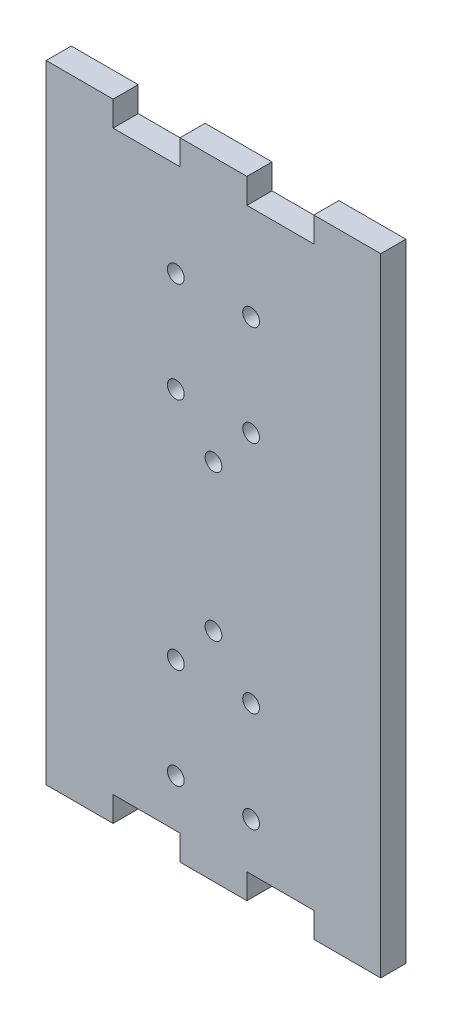
from build123d import *

# Parameters (mm, degrees)
BOSS_EXTRUDE1_DEPTH = 6
CUT_EXTRUDE1_REACH  = 87.212
SKETCH2_R           = 2
CUT_EXTRUDE2_REACH  = 87.212
SKETCH3_R           = 2


with BuildPart() as part:
    # Sketch1 → Boss-Extrude1 (new body)
    with BuildSketch(Plane.XY):
        Polygon((-24, 69), (-8, 69), (-8, 75), (8, 75), (8, 69), (24, 69), (24, 75), (40, 75), (40, -75), (24, -75), (24, -69), (8, -69), (8, -75), (-8, -75), (-8, -69), (-24, -69), (-24, -75), (-40, -75), (-40, 75), (-24, 75), align=None)
    extrude(amount=BOSS_EXTRUDE1_DEPTH)

    # Sketch2 → Cut-Extrude1 (cut, up to next)
    with BuildSketch(Plane.XY.offset(6), mode=Mode.PRIVATE) as cut_extrude1_sk1:
        with Locations((9, 46.38172871)):
            Circle(SKETCH2_R)
    cut_extrude1_tool1 = extrude(cut_extrude1_sk1.sketch, amount=-CUT_EXTRUDE1_REACH, mode=Mode.PRIVATE) & part.part
    # Sketch2 → Cut-Extrude1 (cut, up to next)
    with BuildSketch(Plane.XY.offset(6), mode=Mode.PRIVATE) as cut_extrude1_sk2:
        with Locations((9, 22.38172871)):
            Circle(SKETCH2_R)
    cut_extrude1_tool2 = extrude(cut_extrude1_sk2.sketch, amount=-CUT_EXTRUDE1_REACH, mode=Mode.PRIVATE) & part.part
    # Sketch2 → Cut-Extrude1 (cut, up to next)
    with BuildSketch(Plane.XY.offset(6), mode=Mode.PRIVATE) as cut_extrude1_sk3:
        with Locations((-9, 22.38172871)):
            Circle(SKETCH2_R)
    cut_extrude1_tool3 = extrude(cut_extrude1_sk3.sketch, amount=-CUT_EXTRUDE1_REACH, mode=Mode.PRIVATE) & part.part
    # Sketch2 → Cut-Extrude1 (cut, up to next)
    with BuildSketch(Plane.XY.offset(6), mode=Mode.PRIVATE) as cut_extrude1_sk4:
        with Locations((-9, 46.38172871)):
            Circle(SKETCH2_R)
    cut_extrude1_tool4 = extrude(cut_extrude1_sk4.sketch, amount=-CUT_EXTRUDE1_REACH, mode=Mode.PRIVATE) & part.part
    # Sketch2 → Cut-Extrude1 (cut, up to next)
    with BuildSketch(Plane.XY.offset(6), mode=Mode.PRIVATE) as cut_extrude1_sk5:
        with Locations((-9, -57.61827129)):
            Circle(SKETCH2_R)
    cut_extrude1_tool5 = extrude(cut_extrude1_sk5.sketch, amount=-CUT_EXTRUDE1_REACH, mode=Mode.PRIVATE) & part.part
    # Sketch2 → Cut-Extrude1 (cut, up to next)
    with BuildSketch(Plane.XY.offset(6), mode=Mode.PRIVATE) as cut_extrude1_sk6:
        with Locations((-9, -33.61827129)):
            Circle(SKETCH2_R)
    cut_extrude1_tool6 = extrude(cut_extrude1_sk6.sketch, amount=-CUT_EXTRUDE1_REACH, mode=Mode.PRIVATE) & part.part
    # Sketch2 → Cut-Extrude1 (cut, up to next)
    with BuildSketch(Plane.XY.offset(6), mode=Mode.PRIVATE) as cut_extrude1_sk7:
        with Locations((9, -33.61827129)):
            Circle(SKETCH2_R)
    cut_extrude1_tool7 = extrude(cut_extrude1_sk7.sketch, amount=-CUT_EXTRUDE1_REACH, mode=Mode.PRIVATE) & part.part
    # Sketch2 → Cut-Extrude1 (cut, up to next)
    with BuildSketch(Plane.XY.offset(6), mode=Mode.PRIVATE) as cut_extrude1_sk8:
        with Locations((9, -57.61827129)):
            Circle(SKETCH2_R)
    cut_extrude1_tool8 = extrude(cut_extrude1_sk8.sketch, amount=-CUT_EXTRUDE1_REACH, mode=Mode.PRIVATE) & part.part
    add(cut_extrude1_tool1.solids().sort_by_distance((9, 46.381729, 6))[0], mode=Mode.SUBTRACT)
    add(cut_extrude1_tool2.solids().sort_by_distance((9, 22.381729, 6))[0], mode=Mode.SUBTRACT)
    add(cut_extrude1_tool3.solids().sort_by_distance((-9, 22.381729, 6))[0], mode=Mode.SUBTRACT)
    add(cut_extrude1_tool4.solids().sort_by_distance((-9, 46.381729, 6))[0], mode=Mode.SUBTRACT)
    add(cut_extrude1_tool5.solids().sort_by_distance((-9, -57.618271, 6))[0], mode=Mode.SUBTRACT)
    add(cut_extrude1_tool6.solids().sort_by_distance((-9, -33.618271, 6))[0], mode=Mode.SUBTRACT)
    add(cut_extrude1_tool7.solids().sort_by_distance((9, -33.618271, 6))[0], mode=Mode.SUBTRACT)
    add(cut_extrude1_tool8.solids().sort_by_distance((9, -57.618271, 6))[0], mode=Mode.SUBTRACT)

    # Sketch3 → Cut-Extrude2 (cut, up to next)
    with BuildSketch(Plane.XY.offset(6), mode=Mode.PRIVATE) as cut_extrude2_sk1:
        with Locations((0, 11.88172871)):
            Circle(SKETCH3_R)
    cut_extrude2_tool1 = extrude(cut_extrude2_sk1.sketch, amount=-CUT_EXTRUDE2_REACH, mode=Mode.PRIVATE) & part.part
    # Sketch3 → Cut-Extrude2 (cut, up to next)
    with BuildSketch(Plane.XY.offset(6), mode=Mode.PRIVATE) as cut_extrude2_sk2:
        with Locations((0, -23.11827129)):
            Circle(SKETCH3_R)
    cut_extrude2_tool2 = extrude(cut_extrude2_sk2.sketch, amount=-CUT_EXTRUDE2_REACH, mode=Mode.PRIVATE) & part.part
    add(cut_extrude2_tool1.solids().sort_by_distance((0, 11.881729, 6))[0], mode=Mode.SUBTRACT)
    add(cut_extrude2_tool2.solids().sort_by_distance((0, -23.118271, 6))[0], mode=Mode.SUBTRACT)


solid = part.part
